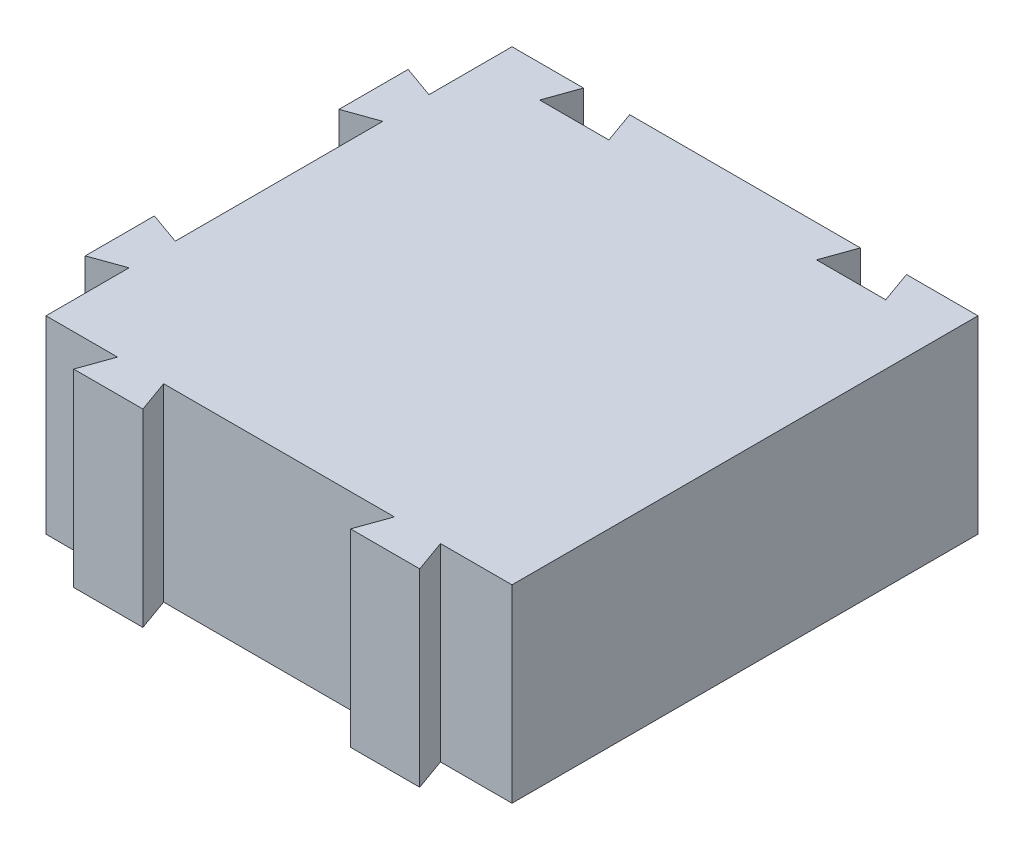
from build123d import *

# Parameters (mm, degrees)
BOSS_EXTRUDE1_DEPTH = 8.2


with BuildPart() as part:
    # Sketch1 → Boss-Extrude1 (new body)
    with BuildSketch(Plane(origin=(0, 0, 0), x_dir=(1, 0, 0), z_dir=(0, 1, 0))):
        Polygon((-10.1, 10.1), (-7, 10.1), (-7.5, 8.7), (-4.5, 8.7), (-5, 10.1), (5, 10.1), (4.5, 8.7), (7.5, 8.7), (7, 10.1), (10.1, 10.1), (10.1, 6.5), (10.1, 4.5), (10.1, -4.5), (10.1, -6.5), (10.1, -10.1), (7, -10.1), (7.5, -11.5), (4.5, -11.5), (5, -10.1), (-5, -10.1), (-4.5, -11.5), (-7.5, -11.5), (-7, -10.1), (-10.1, -10.1), (-10.1, -6.5), (-11.5, -7), (-11.5, -4), (-10.1, -4.5), (-10.1, 4.5), (-11.5, 4), (-11.5, 7), (-10.1, 6.5), align=None)
    extrude(amount=BOSS_EXTRUDE1_DEPTH)


solid = part.part
